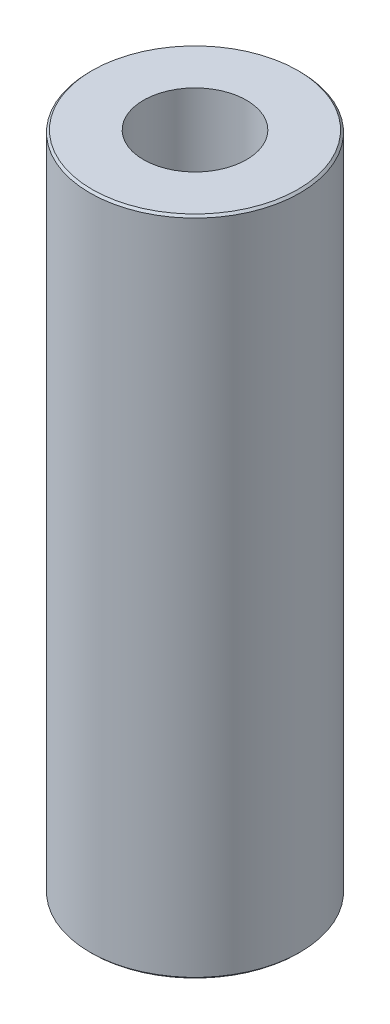
from build123d import *

# Parameters (mm, degrees)
SKETCH1_R           = 50
BOSS_EXTRUDE1_DEPTH = 314.974010068
SKETCH2_R           = 24.526925788
CUT_EXTRUDE1_DEPTH  = 323.813610336
CHAMFER1_SIZE       = 0.994306788


with BuildPart() as part:
    # Sketch1 → Boss-Extrude1 (new body)
    with BuildSketch(Plane(origin=(0, 0, 0), x_dir=(1, 0, 0), z_dir=(0, 1, 0))):
        Circle(SKETCH1_R)
    extrude(amount=BOSS_EXTRUDE1_DEPTH)

    # Sketch2 → Cut-Extrude1 (cut, through all)
    with BuildSketch(Plane(origin=(0, 0, 0), x_dir=(1, 0, 0), z_dir=(0, 1, 0))):
        Circle(SKETCH2_R)
    extrude(amount=CUT_EXTRUDE1_DEPTH, mode=Mode.SUBTRACT)

    # Chamfer1
    chamfer1_edges = [part.edges().sort_by_distance(p)[0] for p in [
        (-50, 314.974010068, 0),
        (-50, 0, 0),
    ]]
    chamfer(chamfer1_edges, length=CHAMFER1_SIZE)


solid = part.part
